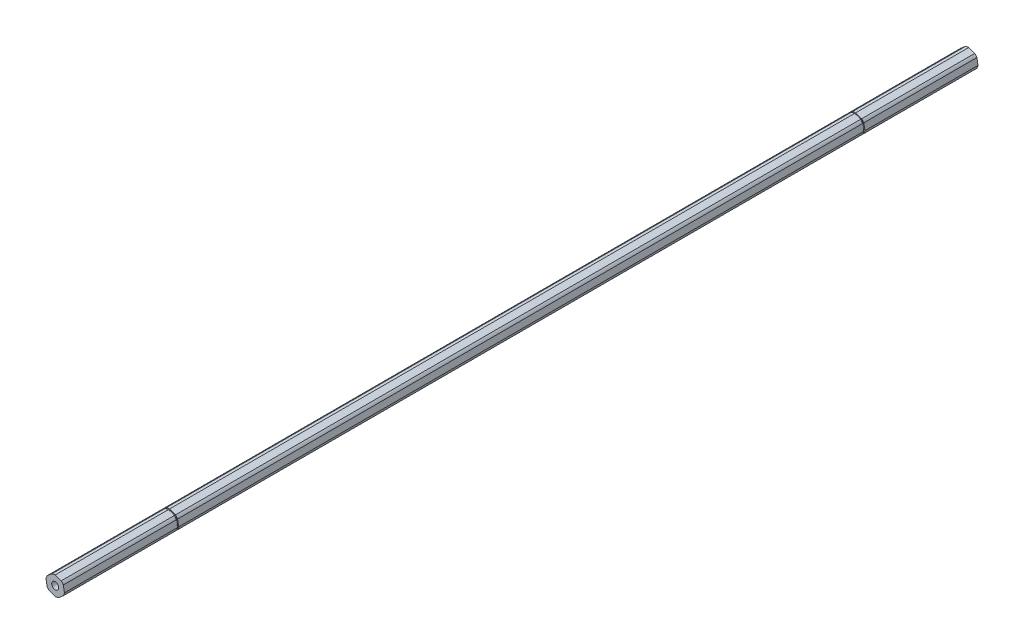
from build123d import *

# Parameters (mm, degrees)
BOSS_EXTRUDE1_DEPTH         = 330.2
SKETCH2_R                   = 2.0193
CUT_EXTRUDE1_DEPTH          = 661.468019978
F_1_4_20_TAPPED_HOLE1_D     = 5.1054
F_1_4_20_TAPPED_HOLE1_DEPTH = 19.05
F_1_4_20_TAPPED_HOLE1_TIP   = 1.533816902
F_1_4_20_TAPPED_HOLE2_D     = 5.1054
F_1_4_20_TAPPED_HOLE2_DEPTH = 19.05
F_1_4_20_TAPPED_HOLE2_TIP   = 1.533816902
SKETCH10_W                  = 0.889
SKETCH10_H                  = 0.8064


with BuildPart() as part:
    # Sketch1 → Boss-Extrude1 (new, symmetric)
    with BuildSketch(Plane.XY):
        with BuildLine():
            Line((-6.654540832, 1.131188008), (-5.845671476, -3.375))
            ThreePointArc((-5.845671476, -3.375), (-5.15742276, -4.354709), (-4.306907968, -5.197407407))
            Line((-4.306907968, -5.197407407), (0, -6.75))
            ThreePointArc((0, -6.75), (1.19257724, -6.643813628), (2.347632865, -6.328595415))
            Line((2.347632865, -6.328595415), (5.845671476, -3.375))
            ThreePointArc((5.845671476, -3.375), (6.35, -2.289104628), (6.654540832, -1.131188008))
            Line((6.654540832, -1.131188008), (5.845671476, 3.375))
            ThreePointArc((5.845671476, 3.375), (5.15742276, 4.354709), (4.306907968, 5.197407407))
            Line((4.306907968, 5.197407407), (0, 6.75))
            ThreePointArc((0, 6.75), (-1.19257724, 6.643813628), (-2.347632865, 6.328595415))
            Line((-2.347632865, 6.328595415), (-5.845671476, 3.375))
            ThreePointArc((-5.845671476, 3.375), (-6.35, 2.289104628), (-6.654540832, 1.131188008))
        make_face()
    extrude(amount=BOSS_EXTRUDE1_DEPTH, both=True)

    # Sketch2 → Cut-Extrude1 (cut, through all)
    with BuildSketch(Plane.XY.offset(330.2)):
        Circle(SKETCH2_R)
    extrude(amount=-CUT_EXTRUDE1_DEPTH, mode=Mode.SUBTRACT)

    # 1/4-20 Tapped Hole1
    with Locations(Plane.XY.offset(330.2)):
        with Locations((0, 0)):
            Hole(F_1_4_20_TAPPED_HOLE1_D / 2, depth=F_1_4_20_TAPPED_HOLE1_DEPTH)
            with Locations((0, 0, -(F_1_4_20_TAPPED_HOLE1_DEPTH + F_1_4_20_TAPPED_HOLE1_TIP / 2))):  # 118° drill point
                Cone(0, F_1_4_20_TAPPED_HOLE1_D / 2, F_1_4_20_TAPPED_HOLE1_TIP, mode=Mode.SUBTRACT)

    # 1/4-20 Tapped Hole2
    with Locations(Plane(origin=(0, 0, -330.2), x_dir=(-1, 0, 0), z_dir=(0, 0, -1))):
        with Locations((0, 0)):
            Hole(F_1_4_20_TAPPED_HOLE2_D / 2, depth=F_1_4_20_TAPPED_HOLE2_DEPTH)
            with Locations((0, 0, -(F_1_4_20_TAPPED_HOLE2_DEPTH + F_1_4_20_TAPPED_HOLE2_TIP / 2))):  # 118° drill point
                Cone(0, F_1_4_20_TAPPED_HOLE2_D / 2, F_1_4_20_TAPPED_HOLE2_TIP, mode=Mode.SUBTRACT)

    # Sketch10 → Cut-Revolve1 (revolve, cut)
    with BuildSketch(Plane(origin=(0, 0.565400242, 0), x_dir=(0, 0, -1), z_dir=(1, 0, 0))):
        with Locations((248.0183, 5.781399758)):
            Rectangle(SKETCH10_W, SKETCH10_H)
    cut_revolve1 = revolve(axis=Axis((0, 0, 0), (0, 0, 1)), mode=Mode.SUBTRACT)

    # Mirror1: Cut-Revolve1 across plane
    add(cut_revolve1.mirror(Plane.XY), mode=Mode.SUBTRACT)


solid = part.part
